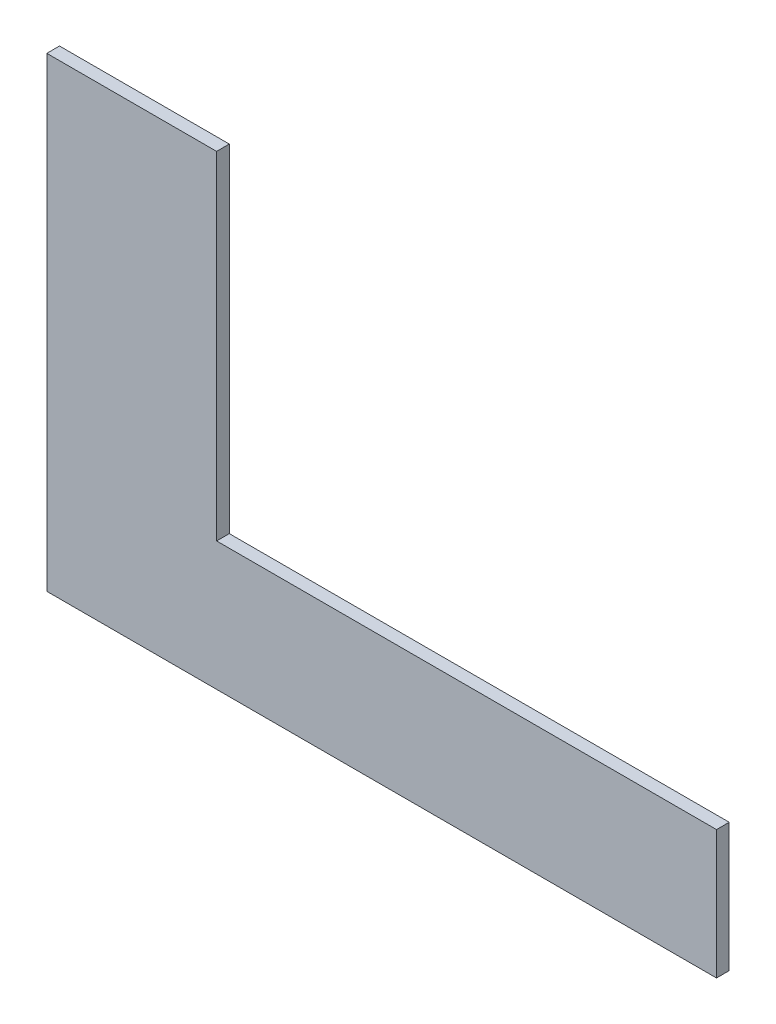
from build123d import *

# Parameters (mm, degrees)
TABAN_FLAN_1_DEPTH         = 40
KES_EKSTR_ZYON1_DEPTH      = 1384.891767514
KES_EKSTR_ZYON1_DEPTH_BACK = 1384.891767514
IZIM2_W                    = 535
IZIM2_H                    = 265
KES_EKSTR_ZYON2_DEPTH      = 1384.891767514
KES_EKSTR_ZYON2_DEPTH_BACK = 1384.891767514
IZIM3_W                    = 1575
IZIM3_H                    = 360
KES_EKSTR_ZYON3_DEPTH      = 1384.891767514
KES_EKSTR_ZYON3_DEPTH_BACK = 1384.891767514
IZIM5_W                    = 535
IZIM5_H                    = 2


# Sheet-metal steps are written as plain solids
with BuildPart() as part:
    # Çizim1 → Taban-Flanş1 (new body)
    with BuildSketch(Plane.XY):
        Polygon((-517.241071282, 843.539135514), (-517.241071282, -126.460864486), (1057.758928718, -126.460864486), (1057.758928718, -891.460864486), (-1052.241071282, -891.460864486), (-1052.241071282, 843.539135514), align=None)
    extrude(amount=-TABAN_FLAN_1_DEPTH)

    # Çizim2 → Kes-Ekstrüzyon1 (cut, two sides: drawn at the far end of the back side and taken through both)
    with BuildSketch(Plane.XY.offset(-KES_EKSTR_ZYON1_DEPTH_BACK)):
        with Locations((-784.741071282, 711.039135514)):
            Rectangle(IZIM2_W, IZIM2_H)
    extrude(amount=KES_EKSTR_ZYON1_DEPTH + KES_EKSTR_ZYON1_DEPTH_BACK, mode=Mode.SUBTRACT)

    # Çizim3 → Kes-Ekstrüzyon2 (cut, two sides: drawn at the far end of the back side and taken through both)
    with BuildSketch(Plane.XY.offset(-KES_EKSTR_ZYON2_DEPTH_BACK)):
        with Locations((270.258928718, -306.460864486)):
            Rectangle(IZIM3_W, IZIM3_H)
    extrude(amount=KES_EKSTR_ZYON2_DEPTH + KES_EKSTR_ZYON2_DEPTH_BACK, mode=Mode.SUBTRACT)

    # Çizim5 → Kes-Ekstrüzyon3 (cut, two sides: drawn at the far end of the back side and taken through both)
    with BuildSketch(Plane.XY.offset(-KES_EKSTR_ZYON3_DEPTH_BACK)):
        with Locations((-784.741071282, 577.539135514)):
            Rectangle(IZIM5_W, IZIM5_H)
    extrude(amount=KES_EKSTR_ZYON3_DEPTH + KES_EKSTR_ZYON3_DEPTH_BACK, mode=Mode.SUBTRACT)


solid = part.part
